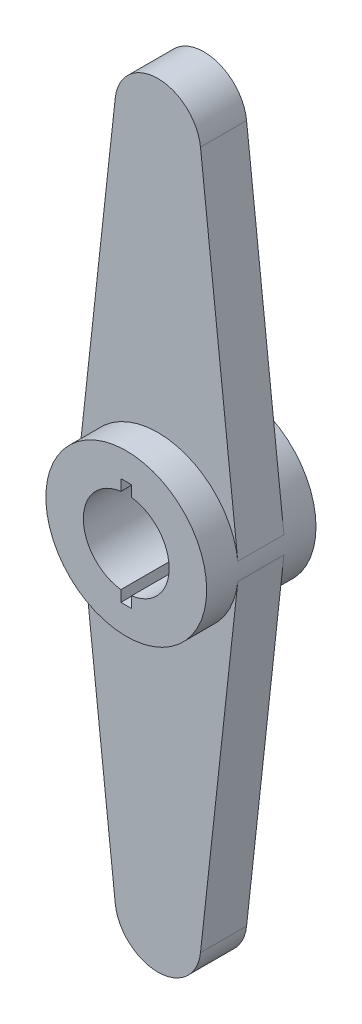
from build123d import *

# Parameters (mm, degrees)
BOSS_EXTRUDE1_DEPTH = 2.55
BOSS_EXTRUDE2_DEPTH = 1.075


with BuildPart() as part:
    # Sketch1 → Boss-Extrude1 (new, symmetric)
    with BuildSketch(Plane.XY):
        with BuildLine():
            ThreePointArc((3.727642468, 0.408878505), (0, 3.75), (-3.727642468, 0.408878505))
            ThreePointArc((-3.727642468, 0.408878505), (-3.75, 0), (-3.727642468, -0.408878505))
            ThreePointArc((-3.727642468, -0.408878505), (0, -3.75), (3.727642468, -0.408878505))
            ThreePointArc((3.727642468, -0.408878505), (3.744406445, -0.204744652), (3.75, 0))
            ThreePointArc((3.75, 0), (3.744406445, 0.204744652), (3.727642468, 0.408878505))
        make_face()
        with BuildLine():
            Line((0.25, -1.984313483), (0.25, -2.5))
            Line((0.25, -2.5), (-0.25, -2.5))
            Line((-0.25, -2.5), (-0.25, -1.984313483))
            ThreePointArc((-0.25, -1.984313483), (-2, 0), (-0.25, 1.984313483))
            Line((-0.25, 1.984313483), (-0.25, 2.5))
            Line((-0.25, 2.5), (0.25, 2.5))
            Line((0.25, 2.5), (0.25, 1.984313483))
            ThreePointArc((0.25, 1.984313483), (1.5, 1.322875656), (2, 0))
            ThreePointArc((2, 0), (1.5, -1.322875656), (0.25, -1.984313483))
        make_face(mode=Mode.SUBTRACT)
    extrude(amount=BOSS_EXTRUDE1_DEPTH, both=True)

    # Sketch2 → Boss-Extrude2 (add, symmetric)
    with BuildSketch(Plane.XY):
        with BuildLine():
            ThreePointArc((3.727642468, -0.408878505), (0, -3.75), (-3.727642468, -0.408878505))
            Line((-3.727642468, -0.408878505), (-1.988075983, -16.268068536))
            ThreePointArc((-1.988075983, -16.268068536), (0, -18.05), (1.988075983, -16.268068536))
            Line((1.988075983, -16.268068536), (3.727642468, -0.408878505))
        make_face()
        with BuildLine():
            Line((-1.988075983, 16.268068536), (-3.727642468, 0.408878505))
            ThreePointArc((-3.727642468, 0.408878505), (0, 3.75), (3.727642468, 0.408878505))
            Line((3.727642468, 0.408878505), (1.988075983, 16.268068536))
            ThreePointArc((1.988075983, 16.268068536), (0, 18.05), (-1.988075983, 16.268068536))
        make_face()
    extrude(amount=BOSS_EXTRUDE2_DEPTH, both=True)


solid = part.part
